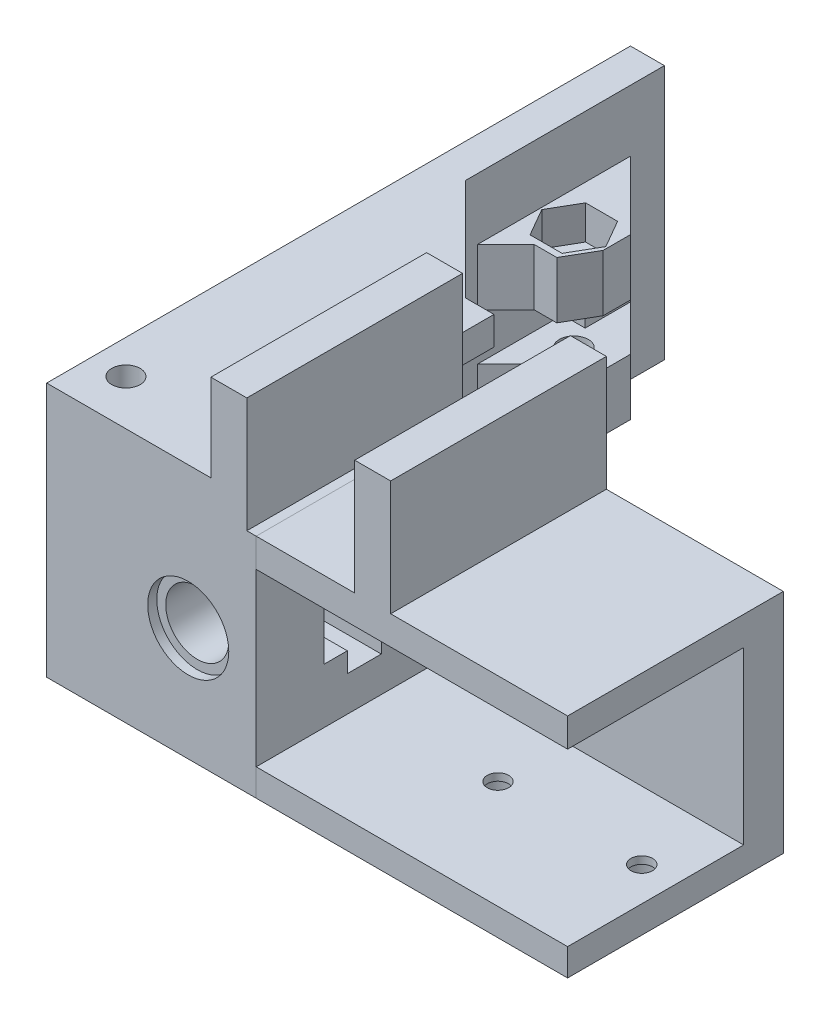
from build123d import *
from OCP.BRepFilletAPI import BRepFilletAPI_MakeChamfer

# Parameters (mm, degrees)
BOSS_EXTRUDE1_DEPTH                             = 38.1
BOSS_EXTRUDE2_DEPTH                             = 38.1
SKETCH3_R                                       = 5.575
CUT_EXTRUDE1_DEPTH                              = 74.915259757
SKETCH4_W                                       = 6
SKETCH4_H                                       = 42
BOSS_EXTRUDE3_DEPTH                             = 65
SKETCH6_W                                       = 23
SKETCH6_H                                       = 11.9
BOSS_EXTRUDE4_DEPTH                             = 5
SKETCH10_R                                      = 2.5
CUT_EXTRUDE4_DEPTH                              = 97.024228713
SKETCH12_W                                      = 14.1
SKETCH12_H                                      = 11
SKETCH12_W_2                                    = 6
SKETCH12_H_2                                    = 18
CUT_EXTRUDE5_DEPTH                              = 15
BOSS_EXTRUDE6_DEPTH                             = 3
BOSS_EXTRUDE6_DEPTH_BACK                        = 1.8
SKETCH13_W                                      = 92
SKETCH13_H                                      = 38.1
SKETCH14_R                                      = 1.5
CUT_EXTRUDE6_DEPTH                              = 4.8
SKETCH15_W                                      = 38.1
SKETCH15_H                                      = 5.08
BOSS_EXTRUDE7_DEPTH                             = 31.25
SKETCH17_R                                      = 7.16
CUT_EXTRUDE7_DEPTH                              = 1.6
SKETCH19_W                                      = 7
SKETCH19_H                                      = 40.08
BOSS_EXTRUDE9_DEPTH                             = 55
SKETCH20_W                                      = 10
SKETCH20_H                                      = 10
BOSS_EXTRUDE10_DEPTH                            = 12
CUT_EXTRUDE8_REACH                              = 99.064
SKETCH21_R                                      = 2.5
CHAMFER2_SIZE                                   = 12
BOSS_EXTRUDE11_START                            = 4
SKETCH22_W                                      = 12
SKETCH22_H                                      = 8.3
SKETCH22_R                                      = 2.5
BOSS_EXTRUDE11_DEPTH                            = 4
CHAMFER3_SIZE                                   = 4
CBORE_FOR_10_SOCKET_HEAD_CAP_SCREW1_D           = 5.1054
CBORE_FOR_10_SOCKET_HEAD_CAP_SCREW1_CBORE_D     = 9.525
CBORE_FOR_10_SOCKET_HEAD_CAP_SCREW1_CBORE_DEPTH = 4.826
CUT_EXTRUDE9_DEPTH                              = 6
CHAMFER7_SIZE                                   = 5
CHAMFER8_SIZE                                   = 18
CHAMFER8_OF_MIRROR2_SIZE                        = 18
BOSS_EXTRUDE12_DEPTH                            = 3
CHAMFER10_SIZE                                  = 3
CHAMFER10_SIZE2                                 = 5.196152423
CBORE_START                                     = -47.7
CBORE_FOR_6_SOCKET_HEAD_CAP_SCREW1_OUTL_R       = 3.57251
CBORE_FOR_6_SOCKET_HEAD_CAP_SCREW1_OUTL_R_2     = 1.5
CBORE_FOR_6_SOCKET_HEAD_CAP_SCREW1_DEPTH        = 3.5052
CBORE_START_2                                   = -44.1948
CBORE_FOR_6_SOCKET_HEAD_CAP_SCREW1_2_OU_R       = 1.89865
CBORE_FOR_6_SOCKET_HEAD_CAP_SCREW1_2_OU_R_2     = 1.5
CBORE_FOR_6_SOCKET_HEAD_CAP_SCREW1_2_DEPTH      = 1.2948
SKETCH11_R                                      = 2.5
CUT_EXTRUDE11_DEPTH                             = 10


# Read off the part's stored shape, not the designer's step: CBORE for #6 Socket Head Cap Screw1, Split1
with BuildPart() as part:
    # Sketch1 → Boss-Extrude1 (new body)
    with BuildSketch(Plane.XY):
        Polygon((-9.525, 7.62), (-9.525, 12.7), (-15.875, 12.7), (-15.875, -12.7), (15.875, -12.7), (15.875, 12.7), (9.525, 12.7), (9.525, 7.62), (9.525, -7.62), (-9.525, -7.62), align=None)
    extrude(amount=BOSS_EXTRUDE1_DEPTH)

    # Sketch2 → Boss-Extrude2 (add)
    with BuildSketch(Plane.XY.offset(38.1)):
        Polygon((-44.875, -44.7), (-7.875, -44.7), (-7.875, -12.7), (-15.875, -12.7), (-15.875, -2.7), (-44.875, -2.7), align=None)
    extrude(amount=-BOSS_EXTRUDE2_DEPTH)

    # Sketch3 → Cut-Extrude1 (cut, through all)
    with BuildSketch(Plane.XY.offset(38.1)):
        with Locations((-19.875, -27.686)):
            Circle(SKETCH3_R)
    extrude(amount=-CUT_EXTRUDE1_DEPTH, mode=Mode.SUBTRACT)

    # Sketch4 → Boss-Extrude3 (add)
    with BuildSketch(Plane(origin=(0, 0, 0), x_dir=(-1, 0, 0), z_dir=(0, 0, -1))):
        with Locations((41.875, -23.7)):
            Rectangle(SKETCH4_W, SKETCH4_H)
    extrude(amount=BOSS_EXTRUDE3_DEPTH)

    # Sketch6 → Boss-Extrude4 (add)
    with BuildSketch(Plane(origin=(0, -2.7, 0), x_dir=(1, 0, 0), z_dir=(0, 1, 0))):
        with Locations((-27.375, 5.95)):
            Rectangle(SKETCH6_W, SKETCH6_H)
        Polygon((-38.875, 0), (-38.875, 11.9), (-44.875, 11.9), (-44.875, -38.1), (-15.875, -38.1), (-15.875, 0), align=None)
    boss_extrude4 = extrude(amount=-BOSS_EXTRUDE4_DEPTH)

    # Sketch10 → Cut-Extrude4 (cut, through all)
    with BuildSketch(Plane.ZY.offset(38.875)):
        with Locations(Location((-50, -27.7, 0), (0, 0, 270))):
            Circle(SKETCH10_R)
    extrude(amount=CUT_EXTRUDE4_DEPTH, mode=Mode.SUBTRACT)

    # Sketch12 → Cut-Extrude5 (cut)
    with BuildSketch(Plane(origin=(-7.875, 0, 58.8), x_dir=(0, 0, 1), z_dir=(-1, 0, 0))):
        with Locations((-39.75, -27.7)):
            Rectangle(SKETCH12_W, SKETCH12_H)
        with Locations((-39.8, -27.7)):
            Rectangle(SKETCH12_W_2, SKETCH12_H_2)
    extrude(amount=CUT_EXTRUDE5_DEPTH, mode=Mode.SUBTRACT)

    # Sketch13 → Boss-Extrude6 (add, two sides: drawn at the far end of the back side and taken through both)
    with BuildSketch(Plane.XZ.offset(44.7).offset(-BOSS_EXTRUDE6_DEPTH_BACK)):
        with Locations((1.125, 19.05)):
            Rectangle(SKETCH13_W, SKETCH13_H)
    extrude(amount=BOSS_EXTRUDE6_DEPTH + BOSS_EXTRUDE6_DEPTH_BACK)

    # Sketch14 → Cut-Extrude6 (cut)
    with BuildSketch(Plane.XZ.offset(47.7)):
        with Locations(Location((15.725, 19, 0), (0, 0, 270))):
            Circle(SKETCH14_R)
        with Locations(Location((41.125, 19, 0), (0, 0, 270))):
            Circle(SKETCH14_R)
    extrude(amount=-CUT_EXTRUDE6_DEPTH, mode=Mode.SUBTRACT)

    # Sketch15 → Boss-Extrude7 (add)
    with BuildSketch(Plane(origin=(15.875, 0, 0), x_dir=(0, 0, -1), z_dir=(1, 0, 0))):
        with Locations((-19.05, -10.16)):
            Rectangle(SKETCH15_W, SKETCH15_H)
    extrude(amount=BOSS_EXTRUDE7_DEPTH)

    # Sketch17 → Cut-Extrude7 (cut)
    with BuildSketch(Plane.XY.offset(38.1)):
        with Locations((-19.875, -27.686)):
            Circle(SKETCH17_R)
    cut_extrude7 = extrude(amount=-CUT_EXTRUDE7_DEPTH, mode=Mode.SUBTRACT)

    # Mirror1: Cut-Extrude7 across plane
    add(cut_extrude7.mirror(Plane.XY.offset(19.05)), mode=Mode.SUBTRACT)

    # Sketch19 → Boss-Extrude9 (add)
    with BuildSketch(Plane(origin=(47.125, 0, 0), x_dir=(0, 0, -1), z_dir=(1, 0, 0))):
        with Locations((-3.5, -27.66)):
            Rectangle(SKETCH19_W, SKETCH19_H)
    extrude(amount=-BOSS_EXTRUDE9_DEPTH)

    # Sketch20 → Boss-Extrude10 (add)
    with BuildSketch(Plane(origin=(-38.875, 0, 0), x_dir=(0, 0, -1), z_dir=(1, 0, 0))):
        with Locations((42, -36.85)):
            Rectangle(SKETCH20_W, SKETCH20_H)
        with Locations((42, -18.55)):
            Rectangle(SKETCH20_W, SKETCH20_H)
    extrude(amount=BOSS_EXTRUDE10_DEPTH)

    # Cut-Extrude8: up to this face of the body (flat: up to its plane)
    cut_extrude8_end = Plane(part.part.faces().sort_by_distance((-32.875, -13.55, -42))[0])
    # Sketch21 → Cut-Extrude8 (cut, up to the picked face)
    with BuildSketch(Plane.XZ.offset(41.85), mode=Mode.PRIVATE) as cut_extrude8_sk1:
        with Locations((-32.875, -43)):
            Circle(SKETCH21_R)
    cut_extrude8_tool1 = split(extrude(cut_extrude8_sk1.sketch, amount=-CUT_EXTRUDE8_REACH, mode=Mode.PRIVATE), bisect_by=cut_extrude8_end, keep=Keep.BOTH, mode=Mode.PRIVATE)
    add(cut_extrude8_tool1.solids().sort_by(Axis((-32.875, -41.85, -43), (0, 1, 0)))[0], mode=Mode.SUBTRACT)

    # Chamfer2
    chamfer2_edges = [part.edges().sort_by_distance(p)[0] for p in [
        (-38.875, -18.55, -47),
        (-38.875, -36.85, -47),
    ]]
    chamfer(chamfer2_edges, length=CHAMFER2_SIZE - 0.0001)  # a hair under: the kernel refuses the full size

    # Sketch22 → Boss-Extrude11 (add)
    with BuildSketch(Plane(origin=(-38.875, 0, 0), x_dir=(0, 0, -1), z_dir=(1, 0, 0)).offset(BOSS_EXTRUDE11_START)):
        with Locations((53, -27.7)):
            Rectangle(SKETCH22_W, SKETCH22_H)
        with Locations(Location((50, -27.7, 0), (0, 0, 90))):
            Circle(SKETCH22_R, mode=Mode.SUBTRACT)
    extrude(amount=-BOSS_EXTRUDE11_DEPTH)

    # Chamfer3
    chamfer3_edges = [part.edges().sort_by_distance(p)[0] for p in [
        (-34.875, -27.7, -59),
    ]]
    chamfer(chamfer3_edges, length=CHAMFER3_SIZE - 0.0001)  # a hair under: the kernel refuses the full size

    # CBORE for #10 Socket Head Cap Screw1 (through all)
    with Locations(Plane(origin=(0, -41.85, 0), x_dir=(-1, 0, 0), z_dir=(0, -1, 0))):
        with Locations((32.875, 43)):
            CounterBoreHole(CBORE_FOR_10_SOCKET_HEAD_CAP_SCREW1_D / 2, CBORE_FOR_10_SOCKET_HEAD_CAP_SCREW1_CBORE_D / 2, CBORE_FOR_10_SOCKET_HEAD_CAP_SCREW1_CBORE_DEPTH)

    # Sketch25 → Cut-Extrude9 (cut)
    with BuildSketch(Plane(origin=(0, -13.55, 0), x_dir=(1, 0, 0), z_dir=(0, 1, 0))):
        Polygon((-35.704016319, 38.1), (-30.045983681, 38.1), (-27.216967362, 43), (-30.045983681, 47.9), (-35.704016319, 47.9), (-38.533032638, 43), align=None)
    extrude(amount=-CUT_EXTRUDE9_DEPTH, mode=Mode.SUBTRACT)

    # Chamfer7
    chamfer7_edges = [part.edges().sort_by_distance(p)[0] for p in [
        (-38.875, -36.85, -37),
        (-38.875, -18.55, -37),
    ]]
    chamfer(chamfer7_edges, length=CHAMFER7_SIZE)

    # Chamfer8
    chamfer8_edges = [part.edges().sort_by_distance(p)[0] for p in [
        (-38.875, -5.2, -11.9),
    ]]
    chamfer(chamfer8_edges, length=CHAMFER8_SIZE)

    # Mirror2: Boss-Extrude4 across plane
    add(boss_extrude4.mirror(Plane(origin=(0, -23.7, 0), x_dir=(0, 0, 1), z_dir=(0, -1, 0))))

    # Chamfer8 of Mirror2
    chamfer8_of_mirror2_edges = [part.edges().sort_by_distance(p)[0] for p in [
        (-38.875, -42.2, -11.9),
    ]]
    chamfer(chamfer8_of_mirror2_edges, length=CHAMFER8_OF_MIRROR2_SIZE)

    # Sketch27 → Boss-Extrude12 (add)
    with BuildSketch(Plane.XZ.offset(44.7)):
        Polygon((-15.875, 0), (-44.875, 0), (-44.875, -65), (-38.875, -65), (-38.875, -29.9), (-20.875, -11.9), (-15.875, -11.9), align=None)
    extrude(amount=BOSS_EXTRUDE12_DEPTH)

    # Chamfer10: one chamfer whose edges measure the first distance from different faces: ONE call of the kernel's chamfer builder (chamfer() names one face for all edges)
    chamfer10_edges_1 = [part.edges().sort_by_distance(p)[0] for p in [
        (-26.875, -36.85, -37),
    ]]
    chamfer10_side_1 = [part.faces().sort_by_distance(p)[0] for p in [
        (-30.375, -36.85, -37),
    ]]
    chamfer10_edges_2 = [part.edges().sort_by_distance(p)[0] for p in [
        (-26.875, -18.55, -37),
    ]]
    chamfer10_side_2 = [part.faces().sort_by_distance(p)[0] for p in [
        (-30.375, -18.55, -37),
    ]]
    chamfer10 = BRepFilletAPI_MakeChamfer(part.part.solid().wrapped)
    for e in chamfer10_edges_1:
        chamfer10.Add(CHAMFER10_SIZE, CHAMFER10_SIZE2, e.wrapped, chamfer10_side_1[0].wrapped)  # the first distance lies on this face
    for e in chamfer10_edges_2:
        chamfer10.Add(CHAMFER10_SIZE, CHAMFER10_SIZE2, e.wrapped, chamfer10_side_2[0].wrapped)  # the first distance lies on this face
    add(Compound.cast(chamfer10.Shape()), mode=Mode.REPLACE)

    # CBORE for #6 Socket Head Cap Screw1 outl → CBORE for #6 Socket Head Cap Screw1 (cut)
    # profile 1 of 2: a face of its own
    with BuildSketch(Plane(origin=(0, 0, 0), x_dir=(1, 0, 0), z_dir=(0, 1, 0)).offset(CBORE_START)):
        with Locations((41.125, -19)):
            Circle(CBORE_FOR_6_SOCKET_HEAD_CAP_SCREW1_OUTL_R)
        with Locations((41.125, -19)):
            Circle(CBORE_FOR_6_SOCKET_HEAD_CAP_SCREW1_OUTL_R_2, mode=Mode.SUBTRACT)
    # profile 2 of 2: a face of its own
    with BuildSketch(Plane(origin=(0, 0, 0), x_dir=(1, 0, 0), z_dir=(0, 1, 0)).offset(CBORE_START)):
        with Locations((15.725, -19)):
            Circle(CBORE_FOR_6_SOCKET_HEAD_CAP_SCREW1_OUTL_R)
        with Locations((15.725, -19)):
            Circle(CBORE_FOR_6_SOCKET_HEAD_CAP_SCREW1_OUTL_R_2, mode=Mode.SUBTRACT)
    extrude(amount=CBORE_FOR_6_SOCKET_HEAD_CAP_SCREW1_DEPTH, mode=Mode.SUBTRACT)

    # CBORE for _6 Socket Head Cap Screw1 2 ou → CBORE for _6 Socket Head Cap Screw1 2 (cut)
    # profile 1 of 2: a face of its own
    with BuildSketch(Plane(origin=(0, 0, 0), x_dir=(1, 0, 0), z_dir=(0, 1, 0)).offset(CBORE_START_2)):
        with Locations((41.125, -19)):
            Circle(CBORE_FOR_6_SOCKET_HEAD_CAP_SCREW1_2_OU_R)
        with Locations((41.125, -19)):
            Circle(CBORE_FOR_6_SOCKET_HEAD_CAP_SCREW1_2_OU_R_2, mode=Mode.SUBTRACT)
    # profile 2 of 2: a face of its own
    with BuildSketch(Plane(origin=(0, 0, 0), x_dir=(1, 0, 0), z_dir=(0, 1, 0)).offset(CBORE_START_2)):
        with Locations((15.725, -19)):
            Circle(CBORE_FOR_6_SOCKET_HEAD_CAP_SCREW1_2_OU_R)
        with Locations((15.725, -19)):
            Circle(CBORE_FOR_6_SOCKET_HEAD_CAP_SCREW1_2_OU_R_2, mode=Mode.SUBTRACT)
    extrude(amount=CBORE_FOR_6_SOCKET_HEAD_CAP_SCREW1_2_DEPTH, mode=Mode.SUBTRACT)


with BuildPart() as body_2:
    # Split1: the piece on the far side of the plane
    add(part.part)
    split(bisect_by=Plane.YZ.offset(-7.875), keep=Keep.BOTTOM)

    # Sketch11 → Cut-Extrude11 (cut)
    with BuildSketch(Plane(origin=(0, -2.7, 0), x_dir=(1, 0, 0), z_dir=(0, 1, 0))):
        with Locations(Location((-38.875, -30.1, 0), (0, 0, 180))):
            Circle(SKETCH11_R)
    extrude(amount=-CUT_EXTRUDE11_DEPTH, mode=Mode.SUBTRACT)


with BuildPart() as part_1:
    add(part.part)

    # Split1
    split(bisect_by=Plane.YZ.offset(-7.875), keep=Keep.TOP)


solid = Compound([body_2.part, part_1.part])
